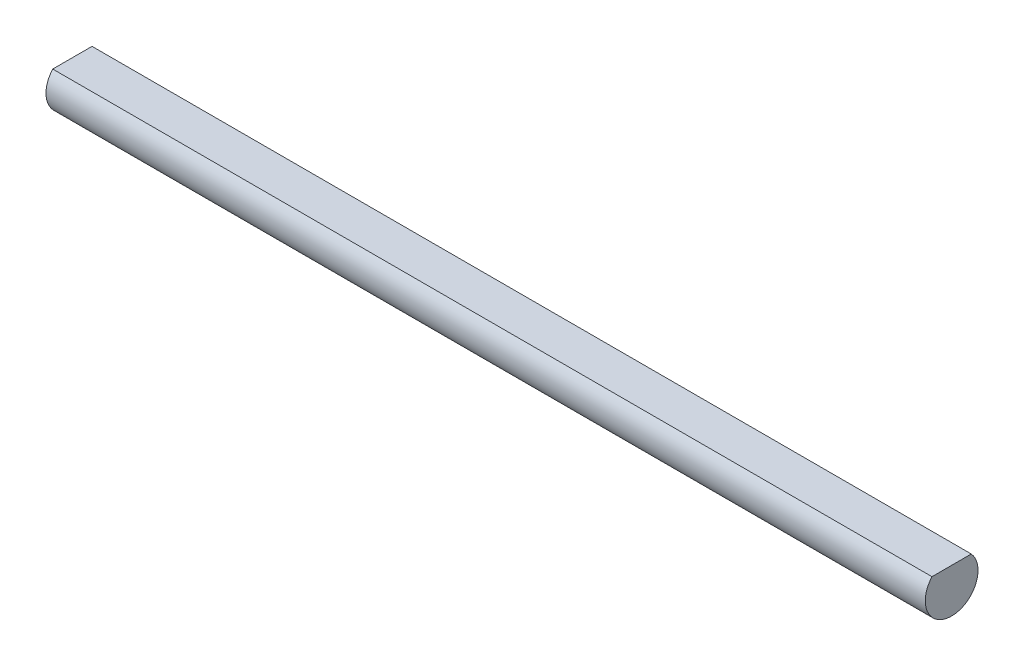
from build123d import *

# Parameters (mm, degrees)
BOSS_EXTRUDE1_DEPTH = 50


with BuildPart() as part:
    # Sketch1 → Boss-Extrude1 (new, symmetric)
    with BuildSketch(Plane(origin=(0, 0, 0), x_dir=(0, 0, -1), z_dir=(1, 0, 0))):
        with BuildLine():
            Line((-2.236067977, 2), (2.236067977, 2))
            ThreePointArc((2.236067977, 2), (0, -3), (-2.236067977, 2))
        make_face()
    extrude(amount=BOSS_EXTRUDE1_DEPTH, both=True)


solid = part.part
